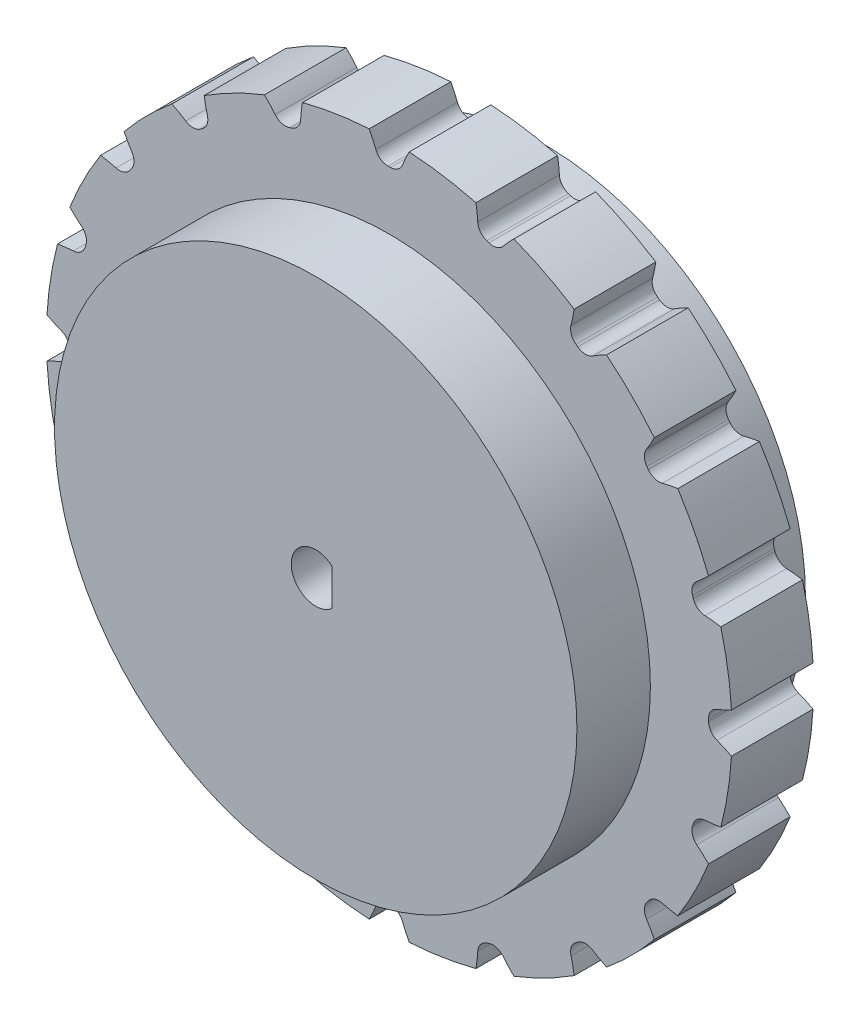
from build123d import *

# Parameters (mm, degrees)
SKETCH_1_R                       = 21
SKETCH_1_R_2                     = 0.25
EXTRUDE_1_DEPTH                  = 5
CUT_EXTRUDE_1_DEPTH              = 31.116440693
SKETCH_4_R                       = 21
EXTRUDE_2_DEPTH                  = 5
CUT_EXTRUDE_2_DEPTH              = 31.116440693
FILLET_1_R                       = 0.8
PATTERN_CIRCULAR_1_COUNT         = 20
FILLET_1_OF_PATTERN_CIRCULAR_1_R = 0.8
EXTRUDE_START                    = 5
SKETCH_7_R                       = 16
EXTRUDE_3_DEPTH                  = 4.5
EXTRUDE_START_2                  = -4.5
SKETCH_7_3_R                     = 16
EXTRUDE_4_DEPTH                  = 4.5
CUT_EXTRUDE_3_DEPTH              = 32.132805039
CUT_EXTRUDE_3_DEPTH_BACK         = 32.132805039
SKETCH_6_R                       = 1.75
CUT_EXTRUDE_START                = -4.5
SKETCH_6_3_R                     = 3.1
CUT_EXTRUDE_4_DEPTH              = 2.6
CUT_EXTRUDE_START_2              = 9.5
SKETCH_6_4_R                     = 3.1
SKETCH_6_4_R_2                   = 1.75
CUT_EXTRUDE_5_DEPTH              = 2.6
EXTRUDE_5_DEPTH                  = 9.5
EXTRUDE_5_DEPTH_BACK             = 4.5
SKETCH_8_R                       = 4
CUT_EXTRUDE_6_DEPTH              = 32.132805039
CUT_EXTRUDE_6_DEPTH_BACK         = 32.132805039


with BuildPart() as part:
    # 草图1 → 凸台-拉伸1 (new body)
    with BuildSketch(Plane.XY):
        Circle(SKETCH_1_R)
        Circle(SKETCH_1_R_2, mode=Mode.SUBTRACT)
    extrude(amount=EXTRUDE_1_DEPTH)

    # 草图1<3> → 切除-拉伸1 (cut, through all)
    with BuildSketch(Plane.XY):
        with BuildLine():
            Line((18.787093754, 0.503981044), (18.743257109, 0.502805085))
            ThreePointArc((18.743257109, 0.502805085), (18.748314201, 0.251425148), (18.75, 0))
            ThreePointArc((18.75, 0), (18.748314201, -0.251425148), (18.743257109, -0.502805085))
            Line((18.743257109, -0.502805085), (18.787093754, -0.503981044))
            add(Edge.make_bspline(
                [(18.787093754, -0.503981044), (18.822839062, -0.504939944), (18.894172863, -0.509054569), (19.036211691, -0.525962467), (19.303863929, -0.574855793), (19.657528446, -0.667430823), (20.136157652, -0.832555574), (20.534451535, -1.006789415), (20.808220855, -1.142251118), (20.964273672, -1.224430229)],
                knots=[0, 0, 0, 0, 0, 0.001401017, 0.002802034, 0.005604068, 0.010661158, 0.015718248, 0.022633196, 0.022633196, 0.022633196, 0.022633196, 0.022633196], degree=4))
            ThreePointArc((20.964273672, -1.224430229), (20.991066518, -0.612475664), (21, 0))
            ThreePointArc((21, 0), (20.991066518, 0.612475664), (20.964273672, 1.224430229))
            add(Edge.make_bspline(
                [(18.787093754, 0.503981044), (18.822839062, 0.504939944), (18.894172863, 0.509054569), (19.036211691, 0.525962467), (19.303863929, 0.574855793), (19.657528446, 0.667430823), (20.136157652, 0.832555574), (20.534451535, 1.006789415), (20.808220855, 1.142251118), (20.964273672, 1.224430229)],
                knots=[0, 0, 0, 0, 0, 0.001401017, 0.002802034, 0.005604068, 0.010661158, 0.015718248, 0.022633196, 0.022633196, 0.022633196, 0.022633196, 0.022633196], degree=4))
        make_face()
    extrude(amount=CUT_EXTRUDE_1_DEPTH, mode=Mode.SUBTRACT)

    # 草图4 → 凸台-拉伸2 (add, through all)
    with BuildSketch(Plane.XY):
        Circle(SKETCH_4_R)
    extrude(amount=EXTRUDE_2_DEPTH)

    # 草图5 → 切除-拉伸2 (cut, symmetric)
    with BuildSketch(Plane.XY):
        with BuildLine():
            ThreePointArc((20.964273672, -1.224430229), (21, 0), (20.964273672, 1.224430229))
            add(Edge.make_bspline(
                [(20.964273672, 1.224430229), (20.808220855, 1.142251118), (20.534451535, 1.006789415), (20.184012412, 0.853489661), (19.823735823, 0.725303153), (19.626877159, 0.665229839), (19.553011852, 0.644214377)],
                knots=[0.012757569, 0.012757569, 0.012757569, 0.012757569, 0.012757569, 0.019672516, 0.024729606, 0.027740658, 0.027740658, 0.027740658, 0.027740658, 0.027740658], degree=4))
            ThreePointArc((19.553011852, 0.644214377), (19.56362146, 0), (19.553011852, -0.644214377))
            add(Edge.make_bspline(
                [(19.553011852, -0.644214377), (19.626877159, -0.665229839), (19.823735823, -0.725303153), (20.184012412, -0.853489661), (20.534451535, -1.006789415), (20.808220855, -1.142251118), (20.964273672, -1.224430229)],
                knots=[0.007650107, 0.007650107, 0.007650107, 0.007650107, 0.007650107, 0.010661158, 0.015718248, 0.022633196, 0.022633196, 0.022633196, 0.022633196, 0.022633196], degree=4))
        make_face()
    cut_extrude_2 = extrude(amount=CUT_EXTRUDE_2_DEPTH, both=True, mode=Mode.SUBTRACT)

    # 圆角1
    fillet_1_edges = [part.edges().sort_by_distance(p)[0] for p in [
        (19.553011852, -0.644214377, 2.5),
        (19.553011852, 0.644214377, 2.5),
    ]]
    fillet(fillet_1_edges, radius=FILLET_1_R)

    # 阵列(圆周)1: 切除-拉伸2 ×20 about axis
    pattern_circular_1_axis = Axis((0, 0, 5), (0, 0, 1))
    for i in range(1, PATTERN_CIRCULAR_1_COUNT):
        add(cut_extrude_2.rotate(pattern_circular_1_axis, i * 360 / PATTERN_CIRCULAR_1_COUNT), mode=Mode.SUBTRACT)

    # 圆角1 of 阵列(圆周)1
    fillet_1_of_pattern_circular_1_edges = [part.edges().sort_by_distance(p)[0] for p in [
        (18.795092526, 5.429528672, 2.5),
        (18.396946144, 6.654897235, 2.5),
        (16.19737859, 10.971791625, 2.5),
        (15.440059169, 12.014152384, 2.5),
        (12.014152384, 15.440059169, 2.5),
        (10.971791625, 16.19737859, 2.5),
        (6.654897235, 18.396946144, 2.5),
        (5.429528672, 18.795092526, 2.5),
        (0.644214377, 19.553011852, 2.5),
        (-0.644214377, 19.553011852, 2.5),
        (-5.429528672, 18.795092526, 2.5),
        (-6.654897235, 18.396946144, 2.5),
        (-10.971791625, 16.19737859, 2.5),
        (-12.014152384, 15.440059169, 2.5),
        (-15.440059169, 12.014152384, 2.5),
        (-16.19737859, 10.971791625, 2.5),
        (-18.396946144, 6.654897235, 2.5),
        (-18.795092526, 5.429528672, 2.5),
        (-19.553011852, 0.644214377, 2.5),
        (-19.553011852, -0.644214377, 2.5),
        (-18.795092526, -5.429528672, 2.5),
        (-18.396946144, -6.654897235, 2.5),
        (-16.19737859, -10.971791625, 2.5),
        (-15.440059169, -12.014152384, 2.5),
        (-12.014152384, -15.440059169, 2.5),
        (-10.971791625, -16.19737859, 2.5),
        (-6.654897235, -18.396946144, 2.5),
        (-5.429528672, -18.795092526, 2.5),
        (-0.644214377, -19.553011852, 2.5),
        (0.644214377, -19.553011852, 2.5),
        (5.429528672, -18.795092526, 2.5),
        (6.654897235, -18.396946144, 2.5),
        (10.971791625, -16.19737859, 2.5),
        (12.014152384, -15.440059169, 2.5),
        (15.440059169, -12.014152384, 2.5),
        (16.19737859, -10.971791625, 2.5),
        (18.396946144, -6.654897235, 2.5),
        (18.795092526, -5.429528672, 2.5),
    ]]
    fillet(fillet_1_of_pattern_circular_1_edges, radius=FILLET_1_OF_PATTERN_CIRCULAR_1_R)

    # 草图7 → 凸台-拉伸3 (add)
    with BuildSketch(Plane.XY.offset(EXTRUDE_START)):
        Circle(SKETCH_7_R)
    extrude(amount=EXTRUDE_3_DEPTH)

    # 草图7<3> → 凸台-拉伸4 (add)
    with BuildSketch(Plane.XY.offset(EXTRUDE_START_2)):
        Circle(SKETCH_7_3_R)
    extrude(amount=EXTRUDE_4_DEPTH)

    # 草图6 → 切除-拉伸3 (cut, two sides: drawn at the far end of the back side and taken through both)
    with BuildSketch(Plane.XY.offset(-CUT_EXTRUDE_3_DEPTH_BACK)):
        Circle(SKETCH_6_R)
    extrude(amount=CUT_EXTRUDE_3_DEPTH + CUT_EXTRUDE_3_DEPTH_BACK, mode=Mode.SUBTRACT)

    # 草图6<3> → 切除-拉伸4 (cut)
    with BuildSketch(Plane.XY.offset(CUT_EXTRUDE_START)):
        Circle(SKETCH_6_3_R)
    extrude(amount=CUT_EXTRUDE_4_DEPTH, mode=Mode.SUBTRACT)

    # 草图6<4> → 切除-拉伸5 (cut)
    with BuildSketch(Plane.XY.offset(CUT_EXTRUDE_START_2)):
        Circle(SKETCH_6_4_R)
        Circle(SKETCH_6_4_R_2, mode=Mode.SUBTRACT)
    extrude(amount=-CUT_EXTRUDE_5_DEPTH, mode=Mode.SUBTRACT)

    # 草图8 → 凸台-拉伸5 (add, two sides: drawn at the far end of the back side and taken through both)
    with BuildSketch(Plane.XY.offset(-EXTRUDE_5_DEPTH_BACK)):
        Circle(SKETCH_8_R)
    extrude(amount=EXTRUDE_5_DEPTH + EXTRUDE_5_DEPTH_BACK)

    # 草图8<3> → 切除-拉伸6 (cut, two sides: drawn at the far end of the back side and taken through both)
    with BuildSketch(Plane.XY.offset(-CUT_EXTRUDE_6_DEPTH_BACK)):
        with BuildLine():
            Line((1, -1.118033989), (1, 1.118033989))
            ThreePointArc((1, 1.118033989), (-1.5, 0), (1, -1.118033989))
        make_face()
    extrude(amount=CUT_EXTRUDE_6_DEPTH + CUT_EXTRUDE_6_DEPTH_BACK, mode=Mode.SUBTRACT)


solid = part.part
